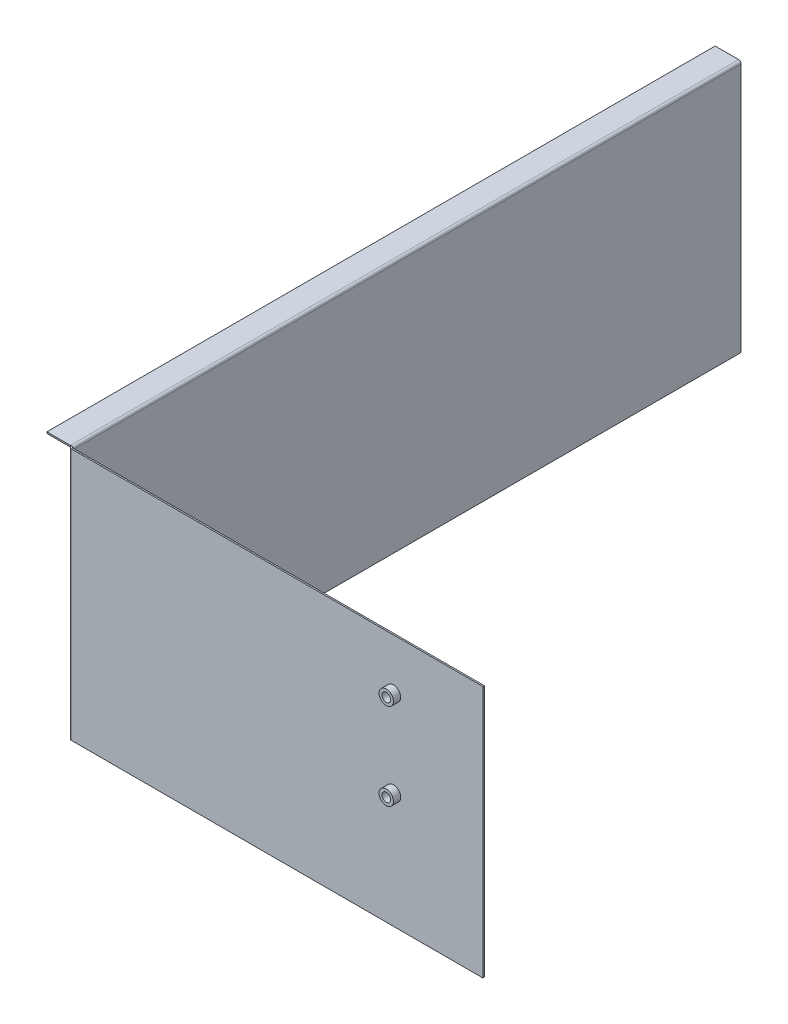
from build123d import *

# Parameters (mm, degrees)
SKETCH1_W                    = 287
SKETCH1_H                    = 175
BASE_FLANGE1_DEPTH           = 1
EDGE_FLANGE1_STRIP_W         = 5.4732
EDGE_FLANGE1_STRIP_H         = 1
EDGE_FLANGE1_STRIP_CUT_DEPTH = 175
EDGE_FLANGE1_DEPTH           = 175
EDGE_FLANGE2_STRIP_W         = 5.4732
EDGE_FLANGE2_STRIP_H         = 1
EDGE_FLANGE2_STRIP_CUT_DEPTH = 463.2634
EDGE_FLANGE2_DEPTH           = 463.2634
SKETCH17_R                   = 4.794
SKETCH17_R_2                 = 2.794
BOSS_EXTRUDE1_DEPTH          = 18
SKETCH21_R                   = 5
SKETCH21_R_2                 = 3
BOSS_EXTRUDE2_DEPTH          = 5


# Sheet-metal steps are written as plain solids
with BuildPart() as part:
    # Sketch1 → Base-Flange1 (new body)
    with BuildSketch(Plane.XY):
        Rectangle(SKETCH1_W, SKETCH1_H)
    extrude(amount=-BASE_FLANGE1_DEPTH)

    # Edge-Flange1 strip (across the edge) → Edge-Flange1 strip cut (cut)
    with BuildSketch(Plane(origin=(-143.5, -87.5, -1), x_dir=(1, 0, 0), z_dir=(0, 1, 0))):
        with Locations((-1, -0.5)):
            Rectangle(EDGE_FLANGE1_STRIP_W, EDGE_FLANGE1_STRIP_H)
    extrude(amount=EDGE_FLANGE1_STRIP_CUT_DEPTH, mode=Mode.SUBTRACT)

    # Edge-Flange1 section (across the edge) → Edge-Flange1 (add)
    with BuildSketch(Plane(origin=(-143.5, -87.5, -1), x_dir=(1, 0, 0), z_dir=(0, 1, 0))):
        with BuildLine():
            Line((0, 0.7366), (0, 464))
            Line((0, 464), (1, 464))
            Line((1, 464), (1, 0.7366))
            ThreePointArc((1, 0.7366), (1.215745145, 0.215745145), (1.7366, 0))
            Line((1.7366, 0), (1.7366, -1))
            ThreePointArc((1.7366, -1), (0.508638364, -0.491361636), (0, 0.7366))
        make_face()
    extrude(amount=EDGE_FLANGE1_DEPTH)

    # Edge-Flange2 strip (across the edge) → Edge-Flange2 strip cut (cut)
    with BuildSketch(Plane(origin=(-143.5, 87.5, -1.7366), x_dir=(0, -1, 0), z_dir=(0, 0, -1))):
        with Locations((-1, -0.5)):
            Rectangle(EDGE_FLANGE2_STRIP_W, EDGE_FLANGE2_STRIP_H)
    extrude(amount=EDGE_FLANGE2_STRIP_CUT_DEPTH, mode=Mode.SUBTRACT)

    # Edge-Flange2 section (across the edge) → Edge-Flange2 (add)
    with BuildSketch(Plane(origin=(-143.5, 87.5, -1.7366), x_dir=(0, -1, 0), z_dir=(0, 0, -1))):
        with BuildLine():
            Line((0, 0.7366), (0, 17))
            Line((0, 17), (1, 17))
            Line((1, 17), (1, 0.7366))
            ThreePointArc((1, 0.7366), (1.215745145, 0.215745145), (1.7366, 0))
            Line((1.7366, 0), (1.7366, -1))
            ThreePointArc((1.7366, -1), (0.508638364, -0.491361636), (0, 0.7366))
        make_face()
    extrude(amount=EDGE_FLANGE2_DEPTH)

    # Sketch17 → Boss-Extrude1 (add)
    # profile 1 of 4: a face of its own
    with BuildSketch(Plane.ZY.offset(143.5)):
        with Locations((-72.584668807, 78.453866984)):
            Circle(SKETCH17_R)
        with Locations((-72.584668807, 78.453866984)):
            Circle(SKETCH17_R_2, mode=Mode.SUBTRACT)
    # profile 2 of 4: a face of its own
    with BuildSketch(Plane.ZY.offset(143.5)):
        with Locations((-182.592068807, 78.453866984)):
            Circle(SKETCH17_R)
        with Locations((-182.592068807, 78.453866984)):
            Circle(SKETCH17_R_2, mode=Mode.SUBTRACT)
    # profile 3 of 4: a face of its own
    with BuildSketch(Plane.ZY.offset(143.5)):
        with Locations((-292.599468807, 78.453866984)):
            Circle(SKETCH17_R)
        with Locations((-292.599468807, 78.453866984)):
            Circle(SKETCH17_R_2, mode=Mode.SUBTRACT)
    # profile 4 of 4: a face of its own
    with BuildSketch(Plane.ZY.offset(143.5)):
        with Locations((-402.606868807, 78.453866984)):
            Circle(SKETCH17_R)
        with Locations((-402.606868807, 78.453866984)):
            Circle(SKETCH17_R_2, mode=Mode.SUBTRACT)
    extrude(amount=BOSS_EXTRUDE1_DEPTH)

    # Sketch21 → Boss-Extrude2 (add)
    # profile 1 of 2: a face of its own
    with BuildSketch(Plane.XY):
        with Locations(Location((81.5, 52.5, 0), (0, 0, 180))):
            Circle(SKETCH21_R)
        with Locations((81.5, 52.5)):
            Circle(SKETCH21_R_2, mode=Mode.SUBTRACT)
    # profile 2 of 2: a face of its own
    with BuildSketch(Plane.XY):
        with Locations(Location((81.5, -7.5, 0), (0, 0, 180))):
            Circle(SKETCH21_R)
        with Locations((81.5, -7.5)):
            Circle(SKETCH21_R_2, mode=Mode.SUBTRACT)
    extrude(amount=BOSS_EXTRUDE2_DEPTH)


solid = part.part
